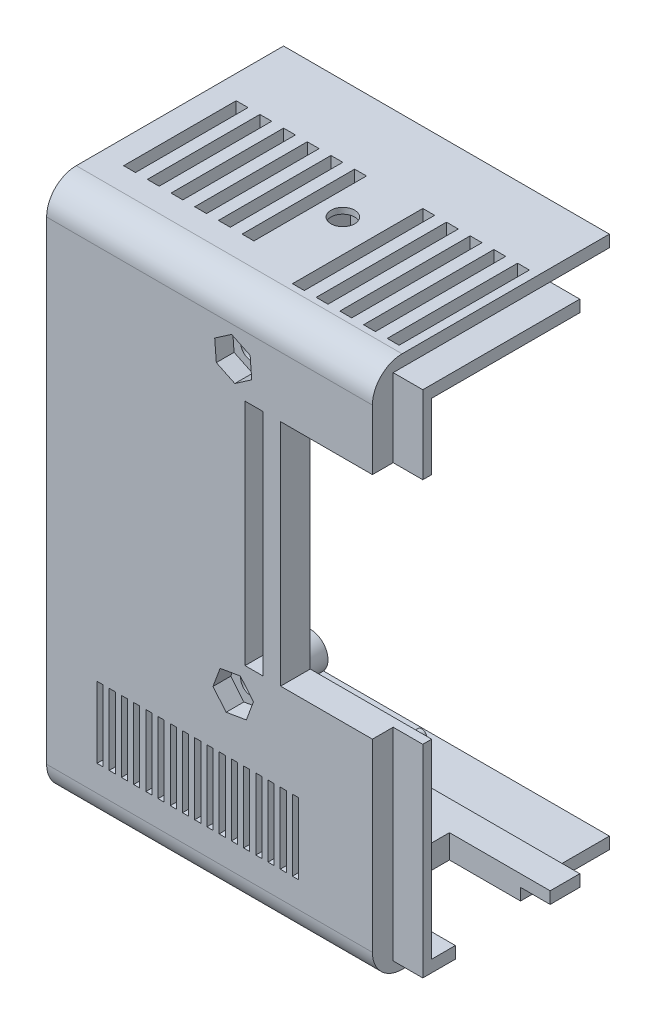
from build123d import *

# Parameters (mm, degrees)
SKETCH1_W                       = 110
SKETCH1_H                       = 90
SKETCH1_R                       = 1.75
BOSS_EXTRUDE1_DEPTH             = 5
SKETCH2_R                       = 3
BOSS_EXTRUDE2_DEPTH             = 8
CUT_EXTRUDE1_REACH              = 78.118
SKETCH3_R                       = 1.5
CUT_EXTRUDE2_DEPTH              = 3
SKETCH5_W                       = 5
SKETCH5_H                       = 90
BOSS_EXTRUDE3_DEPTH             = 35
CUT_EXTRUDE3_REACH              = 121.478
SKETCH6_W                       = 4.5
SKETCH6_H                       = 4
SKETCH6_R                       = 1.75
SKETCH7_R                       = 2.25
BOSS_EXTRUDE4_DEPTH             = 2
CUT_EXTRUDE4_REACH              = 119.724
SKETCH8_R                       = 1.5
SKETCH9_W                       = 105
SKETCH9_H                       = 4
BOSS_EXTRUDE5_DEPTH             = 35
CUT_EXTRUDE7_REACH              = 112.549
SKETCH13_W                      = 50
SKETCH13_H                      = 16
SKETCH15_W                      = 3
SKETCH15_H                      = 19.333856647
CUT_EXTRUDE9_DEPTH              = 10
SKETCH18_R                      = 5
BOSS_EXTRUDE7_DEPTH             = 35
CUT_EXTRUDE10_REACH             = 121.478
SKETCH20_R                      = 3
CUT_EXTRUDE11_REACH             = 87
SKETCH21_R                      = 1.75
CUT_EXTRUDE12_DEPTH             = 30
CUT_EXTRUDE13_REACH             = 112.549
SKETCH23_R                      = 2
CUT_EXTRUDE13_DIRECTION_2_REACH = 112.549
CUT_EXTRUDE14_DEPTH             = 3
CUT_EXTRUDE15_DEPTH             = 3
SKETCH27_R                      = 2.5
BOSS_EXTRUDE9_DEPTH             = 10
SKETCH28_R                      = 0.85
BOSS_EXTRUDE10_DEPTH            = 3
SKETCH29_W                      = 2
SKETCH29_H                      = 82
BOSS_EXTRUDE11_DEPTH            = 10
CUT_EXTRUDE16_DEPTH             = 10
FILLET3_R                       = 5
FILLET4_R                       = 5
SKETCH32_W                      = 9
SKETCH32_H                      = 38.667713294
SKETCH32_W_2                    = 6
CUT_EXTRUDE17_DEPTH             = 35
CHAMFER1_SIZE                   = 3
CHAMFER1_SIZE_2                 = 5.196152423
SKETCH34_W                      = 2
SKETCH34_H                      = 82
BOSS_EXTRUDE12_DEPTH            = 25
SKETCH35_W                      = 1
SKETCH35_H                      = 82
CUT_EXTRUDE18_DEPTH             = 10
CUT_EXTRUDE19_REACH             = 124.123
SKETCH36_W                      = 20
SKETCH36_H                      = 39
CUT_EXTRUDE21_REACH             = 84.765
SKETCH38_W                      = 1
SKETCH38_H                      = 12
SKETCH38_W_2                    = 1.03125
CUT_EXTRUDE22_DEPTH             = 5
SKETCH40_W                      = 2
SKETCH40_H                      = 22
CUT_EXTRUDE26_DEPTH             = 10
CUT_EXTRUDE30_DEPTH             = 5
CUT_EXTRUDE31_DEPTH             = 83.764726786
CUT_EXTRUDE31_DEPTH_BACK        = 83.764726786
SKETCH44_W                      = 55
SKETCH44_H                      = 90
SKETCH45_W                      = 5
SKETCH45_H                      = 2
BOSS_EXTRUDE13_DEPTH            = 5
CUT_EXTRUDE32_REACH             = 84.765
SKETCH46_W                      = 32.5
SKETCH46_H                      = 82
SKETCH48_W                      = 2
SKETCH48_H                      = 3
BOSS_EXTRUDE14_DEPTH            = 22.5
SKETCH49_W                      = 2
SKETCH49_H                      = 76
BOSS_EXTRUDE15_DEPTH            = 4
SKETCH50_W                      = 1
SKETCH50_H                      = 5
SKETCH50_H_2                    = 7
BOSS_EXTRUDE16_DEPTH            = 10
CUT_EXTRUDE33_START             = -4
SKETCH52_W                      = 2
SKETCH52_H                      = 19
CUT_EXTRUDE33_DEPTH             = 4
CUT_EXTRUDE34_REACH             = 110.743
SKETCH53_W                      = 2
SKETCH53_H                      = 19
BOSS_EXTRUDE17_START            = -10
SKETCH54_W                      = 2.68
SKETCH54_H                      = 2.5
BOSS_EXTRUDE17_DEPTH            = 10


with BuildPart() as part:
    # Sketch1 → Boss-Extrude1 (new body)
    with BuildSketch(Plane.XY):
        with Locations((5, 0)):
            Rectangle(SKETCH1_W, SKETCH1_H)
        with Locations((39.5, 35)):
            Circle(SKETCH1_R, mode=Mode.SUBTRACT)
        with Locations((-18.5, 35)):
            Circle(SKETCH1_R, mode=Mode.SUBTRACT)
        with Locations((-18.5, -14)):
            Circle(SKETCH1_R, mode=Mode.SUBTRACT)
        with Locations((39.5, -14)):
            Circle(SKETCH1_R, mode=Mode.SUBTRACT)
    extrude(amount=BOSS_EXTRUDE1_DEPTH)

    # Sketch2 → Boss-Extrude2 (add)
    with BuildSketch(Plane(origin=(0, 0, 0), x_dir=(-1, 0, 0), z_dir=(0, 0, -1))):
        with Locations(Location((-39.5, 35, 0), (0, 0, 180))):
            Circle(SKETCH2_R)
        with Locations(Location((-39.5, -14, 0), (0, 0, 180))):
            Circle(SKETCH2_R)
        with Locations(Location((18.5, -14, 0), (0, 0, 180))):
            Circle(SKETCH2_R)
        with Locations(Location((18.5, 35, 0), (0, 0, 180))):
            Circle(SKETCH2_R)
    extrude(amount=BOSS_EXTRUDE2_DEPTH)

    # Sketch3 → Cut-Extrude1 (cut, up to next)
    with BuildSketch(Plane(origin=(0, 0, -8), x_dir=(-1, 0, 0), z_dir=(0, 0, -1)), mode=Mode.PRIVATE) as cut_extrude1_sk1:
        with Locations((-39.5, 35)):
            Circle(SKETCH3_R)
    cut_extrude1_tool1 = extrude(cut_extrude1_sk1.sketch, amount=-CUT_EXTRUDE1_REACH, mode=Mode.PRIVATE) & part.part
    # Sketch3 → Cut-Extrude1 (cut, up to next)
    with BuildSketch(Plane(origin=(0, 0, -8), x_dir=(-1, 0, 0), z_dir=(0, 0, -1)), mode=Mode.PRIVATE) as cut_extrude1_sk2:
        with Locations((18.5, 35)):
            Circle(SKETCH3_R)
    cut_extrude1_tool2 = extrude(cut_extrude1_sk2.sketch, amount=-CUT_EXTRUDE1_REACH, mode=Mode.PRIVATE) & part.part
    # Sketch3 → Cut-Extrude1 (cut, up to next)
    with BuildSketch(Plane(origin=(0, 0, -8), x_dir=(-1, 0, 0), z_dir=(0, 0, -1)), mode=Mode.PRIVATE) as cut_extrude1_sk3:
        with Locations((18.5, -14)):
            Circle(SKETCH3_R)
    cut_extrude1_tool3 = extrude(cut_extrude1_sk3.sketch, amount=-CUT_EXTRUDE1_REACH, mode=Mode.PRIVATE) & part.part
    # Sketch3 → Cut-Extrude1 (cut, up to next)
    with BuildSketch(Plane(origin=(0, 0, -8), x_dir=(-1, 0, 0), z_dir=(0, 0, -1)), mode=Mode.PRIVATE) as cut_extrude1_sk4:
        with Locations((-39.5, -14)):
            Circle(SKETCH3_R)
    cut_extrude1_tool4 = extrude(cut_extrude1_sk4.sketch, amount=-CUT_EXTRUDE1_REACH, mode=Mode.PRIVATE) & part.part
    add(cut_extrude1_tool1.solids().sort_by_distance((39.5, 35, -8))[0], mode=Mode.SUBTRACT)
    add(cut_extrude1_tool2.solids().sort_by_distance((-18.5, 35, -8))[0], mode=Mode.SUBTRACT)
    add(cut_extrude1_tool3.solids().sort_by_distance((-18.5, -14, -8))[0], mode=Mode.SUBTRACT)
    add(cut_extrude1_tool4.solids().sort_by_distance((39.5, -14, -8))[0], mode=Mode.SUBTRACT)

    # Sketch4 → Cut-Extrude2 (cut)
    with BuildSketch(Plane.XY.offset(5)):
        Polygon((-21.354132917, 33.036858311), (-18.226935885, 31.546677543), (-15.372802968, 33.509819232), (-15.645867083, 36.963141689), (-18.773064115, 38.453322457), (-21.627197032, 36.490180768), align=None)
        Polygon((38.538923104, 31.671887742), (41.901691314, 32.503626864), (42.86276821, 35.831739122), (40.461076896, 38.328112258), (37.098308686, 37.496373136), (36.13723179, 34.168260878), align=None)
        Polygon((38.235847366, -17.225200477), (41.661029228, -16.707388534), (42.925181863, -13.482188057), (40.764152634, -10.774799523), (37.338970772, -11.292611466), (36.074818137, -14.517811943), align=None)
        Polygon((-19.700941245, -17.249267629), (-16.286522312, -16.664679441), (-15.085581067, -13.415411812), (-17.299058755, -10.750732371), (-20.713477688, -11.335320559), (-21.914418933, -14.584588188), align=None)
    extrude(amount=-CUT_EXTRUDE2_DEPTH, mode=Mode.SUBTRACT)

    # Sketch5 → Boss-Extrude3 (add)
    with BuildSketch(Plane(origin=(0, 0, 0), x_dir=(-1, 0, 0), z_dir=(0, 0, -1))):
        with Locations((-57.5, 0)):
            Rectangle(SKETCH5_W, SKETCH5_H)
    extrude(amount=BOSS_EXTRUDE3_DEPTH)

    # Sketch6 → Cut-Extrude3 (cut, up to next)
    with BuildSketch(Plane.ZY.offset(-55), mode=Mode.PRIVATE) as cut_extrude3_sk1:
        with Locations((-17.25, -2)):
            Rectangle(SKETCH6_W, SKETCH6_H)
    cut_extrude3_tool1 = extrude(cut_extrude3_sk1.sketch, amount=-CUT_EXTRUDE3_REACH, mode=Mode.PRIVATE) & part.part
    # Sketch6 → Cut-Extrude3 (cut, up to next)
    with BuildSketch(Plane.ZY.offset(-55), mode=Mode.PRIVATE) as cut_extrude3_sk2:
        with Locations((-17.25, 2)):
            Rectangle(SKETCH6_W, SKETCH6_H)
    cut_extrude3_tool2 = extrude(cut_extrude3_sk2.sketch, amount=-CUT_EXTRUDE3_REACH, mode=Mode.PRIVATE) & part.part
    # Sketch6 → Cut-Extrude3 (cut, up to next)
    with BuildSketch(Plane.ZY.offset(-55), mode=Mode.PRIVATE) as cut_extrude3_sk3:
        with Locations((-21.75, 2)):
            Rectangle(SKETCH6_W, SKETCH6_H)
    cut_extrude3_tool3 = extrude(cut_extrude3_sk3.sketch, amount=-CUT_EXTRUDE3_REACH, mode=Mode.PRIVATE) & part.part
    # Sketch6 → Cut-Extrude3 (cut, up to next)
    with BuildSketch(Plane.ZY.offset(-55), mode=Mode.PRIVATE) as cut_extrude3_sk4:
        with Locations((-21.75, -2)):
            Rectangle(SKETCH6_W, SKETCH6_H)
    cut_extrude3_tool4 = extrude(cut_extrude3_sk4.sketch, amount=-CUT_EXTRUDE3_REACH, mode=Mode.PRIVATE) & part.part
    # Sketch6 → Cut-Extrude3 (cut, up to next)
    with BuildSketch(Plane.ZY.offset(-55), mode=Mode.PRIVATE) as cut_extrude3_sk5:
        with Locations(Location((-32, -10.5, 0), (0, 0, 270))):
            Circle(SKETCH6_R)
    cut_extrude3_tool5 = extrude(cut_extrude3_sk5.sketch, amount=-CUT_EXTRUDE3_REACH, mode=Mode.PRIVATE) & part.part
    # Sketch6 → Cut-Extrude3 (cut, up to next)
    with BuildSketch(Plane.ZY.offset(-55), mode=Mode.PRIVATE) as cut_extrude3_sk6:
        with Locations(Location((-32, 10.5, 0), (0, 0, 270))):
            Circle(SKETCH6_R)
    cut_extrude3_tool6 = extrude(cut_extrude3_sk6.sketch, amount=-CUT_EXTRUDE3_REACH, mode=Mode.PRIVATE) & part.part
    # Sketch6 → Cut-Extrude3 (cut, up to next)
    with BuildSketch(Plane.ZY.offset(-55), mode=Mode.PRIVATE) as cut_extrude3_sk7:
        with Locations(Location((-19.5, 10.5, 0), (0, 0, 270))):
            Circle(SKETCH6_R)
    cut_extrude3_tool7 = extrude(cut_extrude3_sk7.sketch, amount=-CUT_EXTRUDE3_REACH, mode=Mode.PRIVATE) & part.part
    # Sketch6 → Cut-Extrude3 (cut, up to next)
    with BuildSketch(Plane.ZY.offset(-55), mode=Mode.PRIVATE) as cut_extrude3_sk8:
        with Locations(Location((-19.5, -10.5, 0), (0, 0, 270))):
            Circle(SKETCH6_R)
    cut_extrude3_tool8 = extrude(cut_extrude3_sk8.sketch, amount=-CUT_EXTRUDE3_REACH, mode=Mode.PRIVATE) & part.part
    add(cut_extrude3_tool1.solids().sort_by_distance((55, -2, -17.25))[0], mode=Mode.SUBTRACT)
    add(cut_extrude3_tool2.solids().sort_by_distance((55, 2, -17.25))[0], mode=Mode.SUBTRACT)
    add(cut_extrude3_tool3.solids().sort_by_distance((55, 2, -21.75))[0], mode=Mode.SUBTRACT)
    add(cut_extrude3_tool4.solids().sort_by_distance((55, -2, -21.75))[0], mode=Mode.SUBTRACT)
    add(cut_extrude3_tool5.solids().sort_by_distance((55, -10.5, -32))[0], mode=Mode.SUBTRACT)
    add(cut_extrude3_tool6.solids().sort_by_distance((55, 10.5, -32))[0], mode=Mode.SUBTRACT)
    add(cut_extrude3_tool7.solids().sort_by_distance((55, 10.5, -19.5))[0], mode=Mode.SUBTRACT)
    add(cut_extrude3_tool8.solids().sort_by_distance((55, -10.5, -19.5))[0], mode=Mode.SUBTRACT)

    # Sketch7 → Boss-Extrude4 (add)
    with BuildSketch(Plane.ZY.offset(-55)):
        with Locations(Location((-19.5, 10.5, 0), (0, 0, 90))):
            Circle(SKETCH7_R)
        with Locations(Location((-19.5, -10.5, 0), (0, 0, 90))):
            Circle(SKETCH7_R)
        with Locations(Location((-32, -10.5, 0), (0, 0, 90))):
            Circle(SKETCH7_R)
        with Locations(Location((-32, 10.5, 0), (0, 0, 90))):
            Circle(SKETCH7_R)
    extrude(amount=BOSS_EXTRUDE4_DEPTH)

    # Sketch8 → Cut-Extrude4 (cut, up to next)
    with BuildSketch(Plane.ZY.offset(-53), mode=Mode.PRIVATE) as cut_extrude4_sk1:
        with Locations(Location((-32, 10.5, 0), (0, 0, 270))):
            Circle(SKETCH8_R)
    cut_extrude4_tool1 = extrude(cut_extrude4_sk1.sketch, amount=-CUT_EXTRUDE4_REACH, mode=Mode.PRIVATE) & part.part
    # Sketch8 → Cut-Extrude4 (cut, up to next)
    with BuildSketch(Plane.ZY.offset(-53), mode=Mode.PRIVATE) as cut_extrude4_sk2:
        with Locations(Location((-19.5, 10.5, 0), (0, 0, 270))):
            Circle(SKETCH8_R)
    cut_extrude4_tool2 = extrude(cut_extrude4_sk2.sketch, amount=-CUT_EXTRUDE4_REACH, mode=Mode.PRIVATE) & part.part
    # Sketch8 → Cut-Extrude4 (cut, up to next)
    with BuildSketch(Plane.ZY.offset(-53), mode=Mode.PRIVATE) as cut_extrude4_sk3:
        with Locations(Location((-19.5, -10.5, 0), (0, 0, 270))):
            Circle(SKETCH8_R)
    cut_extrude4_tool3 = extrude(cut_extrude4_sk3.sketch, amount=-CUT_EXTRUDE4_REACH, mode=Mode.PRIVATE) & part.part
    # Sketch8 → Cut-Extrude4 (cut, up to next)
    with BuildSketch(Plane.ZY.offset(-53), mode=Mode.PRIVATE) as cut_extrude4_sk4:
        with Locations(Location((-32, -10.5, 0), (0, 0, 270))):
            Circle(SKETCH8_R)
    cut_extrude4_tool4 = extrude(cut_extrude4_sk4.sketch, amount=-CUT_EXTRUDE4_REACH, mode=Mode.PRIVATE) & part.part
    add(cut_extrude4_tool1.solids().sort_by_distance((53, 10.5, -32))[0], mode=Mode.SUBTRACT)
    add(cut_extrude4_tool2.solids().sort_by_distance((53, 10.5, -19.5))[0], mode=Mode.SUBTRACT)
    add(cut_extrude4_tool3.solids().sort_by_distance((53, -10.5, -19.5))[0], mode=Mode.SUBTRACT)
    add(cut_extrude4_tool4.solids().sort_by_distance((53, -10.5, -32))[0], mode=Mode.SUBTRACT)

    # Sketch9 → Boss-Extrude5 (add)
    with BuildSketch(Plane(origin=(0, 0, 0), x_dir=(-1, 0, 0), z_dir=(0, 0, -1))):
        with Locations((-2.5, 43)):
            Rectangle(SKETCH9_W, SKETCH9_H)
        with Locations((-2.5, -43)):
            Rectangle(SKETCH9_W, SKETCH9_H)
    extrude(amount=BOSS_EXTRUDE5_DEPTH)

    # Sketch13 → Cut-Extrude7 (cut, up to next)
    with BuildSketch(Plane(origin=(0, -41, 0), x_dir=(1, 0, 0), z_dir=(0, 1, 0)), mode=Mode.PRIVATE) as cut_extrude7_sk1:
        with Locations((18, 12)):
            Rectangle(SKETCH13_W, SKETCH13_H)
    cut_extrude7_tool1 = extrude(cut_extrude7_sk1.sketch, amount=-CUT_EXTRUDE7_REACH, mode=Mode.PRIVATE) & part.part
    add(cut_extrude7_tool1.solids().sort_by_distance((18, -41, -12))[0], mode=Mode.SUBTRACT)

    # Sketch15 → Cut-Extrude9 (cut)
    with BuildSketch(Plane.XY.offset(5)):
        with Locations((-15, 0.833071676)):
            Rectangle(SKETCH15_W, SKETCH15_H)
        with Locations((-9, 0.833071676)):
            Rectangle(SKETCH15_W, SKETCH15_H)
        with Locations((-3, 0.833071676)):
            Rectangle(SKETCH15_W, SKETCH15_H)
        with Locations((3, 0.833071676)):
            Rectangle(SKETCH15_W, SKETCH15_H)
        with Locations((9, 0.833071676)):
            Rectangle(SKETCH15_W, SKETCH15_H)
        with Locations((15, 0.833071676)):
            Rectangle(SKETCH15_W, SKETCH15_H)
        with Locations((21, 0.833071676)):
            Rectangle(SKETCH15_W, SKETCH15_H)
        with Locations((27, 0.833071676)):
            Rectangle(SKETCH15_W, SKETCH15_H)
        with Locations((33, 0.833071676)):
            Rectangle(SKETCH15_W, SKETCH15_H)
        with Locations((-15, 20.166928324)):
            Rectangle(SKETCH15_W, SKETCH15_H)
        with Locations((-9, 20.166928324)):
            Rectangle(SKETCH15_W, SKETCH15_H)
        with Locations((-3, 20.166928324)):
            Rectangle(SKETCH15_W, SKETCH15_H)
        with Locations((3, 20.166928324)):
            Rectangle(SKETCH15_W, SKETCH15_H)
        with Locations((9, 20.166928324)):
            Rectangle(SKETCH15_W, SKETCH15_H)
        with Locations((15, 20.166928324)):
            Rectangle(SKETCH15_W, SKETCH15_H)
        with Locations((21, 20.166928324)):
            Rectangle(SKETCH15_W, SKETCH15_H)
        with Locations((27, 20.166928324)):
            Rectangle(SKETCH15_W, SKETCH15_H)
        with Locations((33, 20.166928324)):
            Rectangle(SKETCH15_W, SKETCH15_H)
    extrude(amount=-CUT_EXTRUDE9_DEPTH, mode=Mode.SUBTRACT)

    # Sketch18 → Boss-Extrude7 (add)
    with BuildSketch(Plane(origin=(0, 0, 0), x_dir=(-1, 0, 0), z_dir=(0, 0, -1))):
        with Locations(Location((-49, -35, 0), (0, 0, 180))):
            Circle(SKETCH18_R)
        with Locations(Location((-49, 35, 0), (0, 0, 180))):
            Circle(SKETCH18_R)
    extrude(amount=BOSS_EXTRUDE7_DEPTH)

    # Sketch20 → Cut-Extrude10 (cut, up to next)
    with BuildSketch(Plane.ZY.offset(-55), mode=Mode.PRIVATE) as cut_extrude10_sk1:
        with Locations(Location((-19, -22.892244298, 0), (0, 0, 270))):
            Circle(SKETCH20_R)
    cut_extrude10_tool1 = extrude(cut_extrude10_sk1.sketch, amount=-CUT_EXTRUDE10_REACH, mode=Mode.PRIVATE) & part.part
    # Sketch20 → Cut-Extrude10 (cut, up to next)
    with BuildSketch(Plane.ZY.offset(-55), mode=Mode.PRIVATE) as cut_extrude10_sk2:
        with Locations(Location((-9, -22.892244298, 0), (0, 0, 270))):
            Circle(SKETCH20_R)
    cut_extrude10_tool2 = extrude(cut_extrude10_sk2.sketch, amount=-CUT_EXTRUDE10_REACH, mode=Mode.PRIVATE) & part.part
    add(cut_extrude10_tool1.solids().sort_by_distance((55, -22.892244, -19))[0], mode=Mode.SUBTRACT)
    add(cut_extrude10_tool2.solids().sort_by_distance((55, -22.892244, -9))[0], mode=Mode.SUBTRACT)

    # Sketch21 → Cut-Extrude11 (cut, up to next)
    with BuildSketch(Plane(origin=(0, 0, -35), x_dir=(-1, 0, 0), z_dir=(0, 0, -1)), mode=Mode.PRIVATE) as cut_extrude11_sk1:
        with Locations((-49, 35)):
            Circle(SKETCH21_R)
    cut_extrude11_tool1 = extrude(cut_extrude11_sk1.sketch, amount=-CUT_EXTRUDE11_REACH, mode=Mode.PRIVATE) & part.part
    # Sketch21 → Cut-Extrude11 (cut, up to next)
    with BuildSketch(Plane(origin=(0, 0, -35), x_dir=(-1, 0, 0), z_dir=(0, 0, -1)), mode=Mode.PRIVATE) as cut_extrude11_sk2:
        with Locations((-49, -35)):
            Circle(SKETCH21_R)
    cut_extrude11_tool2 = extrude(cut_extrude11_sk2.sketch, amount=-CUT_EXTRUDE11_REACH, mode=Mode.PRIVATE) & part.part
    add(cut_extrude11_tool1.solids().sort_by_distance((49, 35, -35))[0], mode=Mode.SUBTRACT)
    add(cut_extrude11_tool2.solids().sort_by_distance((49, -35, -35))[0], mode=Mode.SUBTRACT)

    # Sketch22 → Cut-Extrude12 (cut)
    with BuildSketch(Plane.XY.offset(5)):
        Polygon((46.919353747, 38.12317859), (45.254924874, 34.759696783), (47.335571127, 31.636518194), (51.080646253, 31.87682141), (52.745075126, 35.240303217), (50.664428873, 38.363481806), align=None)
        Polygon((52.75277675, -35), (50.876388375, -31.75), (47.123611625, -31.75), (45.24722325, -35), (47.123611625, -38.25), (50.876388375, -38.25), align=None)
    extrude(amount=-CUT_EXTRUDE12_DEPTH, mode=Mode.SUBTRACT)

    # Sketch23 → Cut-Extrude13 (cut, up to next)
    with BuildSketch(Plane(origin=(0, -41, 0), x_dir=(1, 0, 0), z_dir=(0, 1, 0)), mode=Mode.PRIVATE) as cut_extrude13_sk1:
        with Locations(Location((-20, 15, 0), (0, 0, 90))):
            Circle(SKETCH23_R)
    cut_extrude13_tool1 = extrude(cut_extrude13_sk1.sketch, amount=-CUT_EXTRUDE13_REACH, mode=Mode.PRIVATE) & part.part
    add(cut_extrude13_tool1.solids().sort_by_distance((-20, -41, -15))[0], mode=Mode.SUBTRACT)

    # Sketch23 → Cut-Extrude13 direction 2 (cut, up to next)
    with BuildSketch(Plane(origin=(0, -41, 0), x_dir=(1, 0, 0), z_dir=(0, 1, 0)), mode=Mode.PRIVATE) as cut_extrude13_direction_2_sk1:
        with Locations(Location((-20, 15, 0), (0, 0, 90))):
            Circle(SKETCH23_R)
    cut_extrude13_direction_2_tool1 = extrude(cut_extrude13_direction_2_sk1.sketch, amount=CUT_EXTRUDE13_DIRECTION_2_REACH, mode=Mode.PRIVATE) & part.part
    add(cut_extrude13_direction_2_tool1.solids().sort_by_distance((-20, -41, -15))[0], mode=Mode.SUBTRACT)

    # Sketch24 → Cut-Extrude14 (cut)
    with BuildSketch(Plane(origin=(0, 41, 0), x_dir=(-1, 0, 0), z_dir=(0, -1, 0))):
        Polygon((16.535898385, 15), (18.267949192, 12), (21.732050808, 12), (23.464101615, 15), (21.732050808, 18), (18.267949192, 18), align=None)
    extrude(amount=-CUT_EXTRUDE14_DEPTH, mode=Mode.SUBTRACT)

    # Sketch25 → Cut-Extrude15 (cut)
    with BuildSketch(Plane(origin=(0, -41, 0), x_dir=(1, 0, 0), z_dir=(0, 1, 0))):
        Polygon((-23.452057687, 14.711386547), (-21.476082261, 11.866123621), (-18.024024574, 12.154737074), (-16.547942313, 15.288613453), (-18.523917739, 18.133876379), (-21.975975426, 17.845262926), align=None)
    extrude(amount=-CUT_EXTRUDE15_DEPTH, mode=Mode.SUBTRACT)

    # Sketch27 → Boss-Extrude9 (add)
    with BuildSketch(Plane(origin=(0, 0, 0), x_dir=(-1, 0, 0), z_dir=(0, 0, -1))):
        with Locations(Location((4.68, -22, 0), (0, 0, 180))):
            Circle(SKETCH27_R)
        with Locations(Location((4.68, -37.24, 0), (0, 0, 180))):
            Circle(SKETCH27_R)
        with Locations(Location((45.32, -37.24, 0), (0, 0, 180))):
            Circle(SKETCH27_R)
        with Locations(Location((45.32, -22, 0), (0, 0, 180))):
            Circle(SKETCH27_R)
    extrude(amount=BOSS_EXTRUDE9_DEPTH)

    # Sketch28 → Boss-Extrude10 (add)
    with BuildSketch(Plane(origin=(0, 0, -10), x_dir=(-1, 0, 0), z_dir=(0, 0, -1))):
        with Locations((4.68, -22)):
            Circle(SKETCH28_R)
        with Locations((4.68, -37.24)):
            Circle(SKETCH28_R)
        with Locations((45.32, -37.24)):
            Circle(SKETCH28_R)
        with Locations((45.32, -22)):
            Circle(SKETCH28_R)
    extrude(amount=BOSS_EXTRUDE10_DEPTH)

    # Sketch29 → Boss-Extrude11 (add)
    with BuildSketch(Plane(origin=(0, 0, 0), x_dir=(-1, 0, 0), z_dir=(0, 0, -1))):
        with Locations((49, 0)):
            Rectangle(SKETCH29_W, SKETCH29_H)
    extrude(amount=BOSS_EXTRUDE11_DEPTH)

    # Sketch30 → Cut-Extrude16 (cut)
    with BuildSketch(Plane(origin=(0, 0, -35), x_dir=(-1, 0, 0), z_dir=(0, 0, -1))):
        Polygon((-55, 41), (50, 41), (50, 43), (-57, 43), (-57, 15), (-55, 15), align=None)
        Polygon((50, -43), (50, -41), (-55, -41), (-55, -15), (-57, -15), (-57, -43), align=None)
    extrude(amount=-CUT_EXTRUDE16_DEPTH, mode=Mode.SUBTRACT)

    # Fillet3
    fillet3_edges = [part.edges().sort_by_distance(p)[0] for p in [
        (60, 45, -15),
        (60, -45, -15),
    ]]
    fillet(fillet3_edges, radius=FILLET3_R)

    # Fillet4
    fillet4_edges = [part.edges().sort_by_distance(p)[0] for p in [
        (60, 0, 5),
        (2.5, -45, 5),
        (2.5, 45, 5),
        (58.535533906, 43.535533906, 5),
        (58.535533906, -43.535533906, 5),
    ]]
    fillet(fillet4_edges, radius=FILLET4_R)

    # Sketch32 → Cut-Extrude17 (cut)
    with BuildSketch(Plane.XY.offset(5)):
        with Locations((-3, 10.5)):
            Rectangle(SKETCH32_W, SKETCH32_H)
        with Locations((4.5, 10.5)):
            Rectangle(SKETCH32_W_2, SKETCH32_H)
    extrude(amount=-CUT_EXTRUDE17_DEPTH, mode=Mode.SUBTRACT)

    # Chamfer1
    # the kernel refuses this chamfer: 5.196152423, 3 mm, written as the material it takes off along each edge
    with BuildSketch(Plane(origin=(60, -4, -15), x_dir=(0.0578938624026709, 0, 0.9983227437537926), z_dir=(0, 1, 0)), Plane(origin=(60, 4, -24), x_dir=(0.057893862402670936, 0, -0.9983227437537926), z_dir=(0, -1, 0))) as chamfer1_piece_1:
        Polygon((CHAMFER1_SIZE * 0.998322743754, -CHAMFER1_SIZE * 0.0578938624027), (-CHAMFER1_SIZE_2 * 0.0578938623994, -CHAMFER1_SIZE_2 * 0.998322743697), (0, 0), align=None)
    extrude(amount=8, mode=Mode.SUBTRACT)
    with BuildSketch(Plane(origin=(60, 4, -15), x_dir=(0.05789386240267102, 0.9983227437537926, 0), z_dir=(0, 0, -1)), Plane(origin=(60, -4, -24), x_dir=(0.05789386240267082, -0.9983227437537926, 0), z_dir=(0, 0, 1))) as chamfer1_piece_2:
        Polygon((CHAMFER1_SIZE * 0.998322743754, -CHAMFER1_SIZE * 0.0578938624027), (-CHAMFER1_SIZE_2 * 0.0578938623994, -CHAMFER1_SIZE_2 * 0.998322743697), (0, 0), align=None)
    extrude(amount=9, mode=Mode.SUBTRACT)
    with BuildSketch(Plane(origin=(60, -4, -24), x_dir=(0.05789386240267082, -0.9983227437537926, 0), z_dir=(0, 0, 1))) as chamfer1_piece_3a_section:
        Polygon((CHAMFER1_SIZE * 0.998322743754, -CHAMFER1_SIZE * 0.0578938624027), (-CHAMFER1_SIZE_2 * 0.0578938623994, -CHAMFER1_SIZE_2 * 0.998322743697), (0, 0), align=None)
    chamfer1_piece_3a = extrude(amount=22.442891912, mode=Mode.PRIVATE)
    chamfer1_piece_3a = split(chamfer1_piece_3a, bisect_by=Plane(origin=(58.257302597, -4.962009686, -15), z_dir=(0, 0, 1)), keep=Keep.TOP, mode=Mode.PRIVATE)
    with BuildSketch(Plane(origin=(60, -17.442891912, -15), x_dir=(0.0578938624026709, 0, 0.9983227437537926), z_dir=(0, 1, 0))) as chamfer1_piece_3b_section:
        Polygon((CHAMFER1_SIZE * 0.998322743754, -CHAMFER1_SIZE * 0.0578938624027), (-CHAMFER1_SIZE_2 * 0.0578938623994, -CHAMFER1_SIZE_2 * 0.998322743697), (0, 0), align=None)
    chamfer1_piece_3b = extrude(amount=21.442891912, mode=Mode.PRIVATE)
    chamfer1_piece_3b = split(chamfer1_piece_3b, bisect_by=Plane(origin=(58.257302597, -4, -14.037990314), z_dir=(0, -1, 0)), keep=Keep.TOP, mode=Mode.PRIVATE)
    chamfer1_piece_3 = chamfer1_piece_3a & chamfer1_piece_3b
    add(chamfer1_piece_3, mode=Mode.SUBTRACT)
    with BuildSketch(Plane(origin=(60, -4, -15), x_dir=(0.0578938624026709, 0, 0.9983227437537926), z_dir=(0, 1, 0))) as chamfer1_piece_4a_section:
        Polygon((CHAMFER1_SIZE * 0.998322743754, -CHAMFER1_SIZE * 0.0578938624027), (-CHAMFER1_SIZE_2 * 0.0578938623994, -CHAMFER1_SIZE_2 * 0.998322743697), (0, 0), align=None)
    chamfer1_piece_4a = extrude(amount=21.442891912, mode=Mode.PRIVATE)
    chamfer1_piece_4a = split(chamfer1_piece_4a, bisect_by=Plane(origin=(58.257302597, 4, -14.037990314), z_dir=(0, 1, 0)), keep=Keep.TOP, mode=Mode.PRIVATE)
    with BuildSketch(Plane(origin=(60, 4, -1.557108088), x_dir=(0.0578938624026709, 0.9983227437537926, 0), z_dir=(0, 0, -1))) as chamfer1_piece_4b_section:
        Polygon((CHAMFER1_SIZE * 0.998322743754, -CHAMFER1_SIZE * 0.0578938624027), (-CHAMFER1_SIZE_2 * 0.0578938623994, -CHAMFER1_SIZE_2 * 0.998322743697), (0, 0), align=None)
    chamfer1_piece_4b = extrude(amount=22.442891912, mode=Mode.PRIVATE)
    chamfer1_piece_4b = split(chamfer1_piece_4b, bisect_by=Plane(origin=(58.257302597, 4.962009686, -15), z_dir=(0, 0, 1)), keep=Keep.TOP, mode=Mode.PRIVATE)
    chamfer1_piece_4 = chamfer1_piece_4a & chamfer1_piece_4b
    add(chamfer1_piece_4, mode=Mode.SUBTRACT)
    with BuildSketch(Plane(origin=(60, 17.442891912, -24), x_dir=(0.057893862402670936, 0, -0.9983227437537926), z_dir=(0, -1, 0))) as chamfer1_piece_5a_section:
        Polygon((CHAMFER1_SIZE * 0.998322743754, -CHAMFER1_SIZE * 0.0578938624027), (-CHAMFER1_SIZE_2 * 0.0578938623994, -CHAMFER1_SIZE_2 * 0.998322743697), (0, 0), align=None)
    chamfer1_piece_5a = extrude(amount=21.442891912, mode=Mode.PRIVATE)
    chamfer1_piece_5a = split(chamfer1_piece_5a, bisect_by=Plane(origin=(58.257302597, 4, -24.962009686), z_dir=(0, 1, 0)), keep=Keep.TOP, mode=Mode.PRIVATE)
    with BuildSketch(Plane(origin=(60, 4, -15), x_dir=(0.05789386240267102, 0.9983227437537926, 0), z_dir=(0, 0, -1))) as chamfer1_piece_5b_section:
        Polygon((CHAMFER1_SIZE * 0.998322743754, -CHAMFER1_SIZE * 0.0578938624027), (-CHAMFER1_SIZE_2 * 0.0578938623994, -CHAMFER1_SIZE_2 * 0.998322743697), (0, 0), align=None)
    chamfer1_piece_5b = extrude(amount=22.442891912, mode=Mode.PRIVATE)
    chamfer1_piece_5b = split(chamfer1_piece_5b, bisect_by=Plane(origin=(58.257302597, 4.962009686, -24), z_dir=(0, 0, -1)), keep=Keep.TOP, mode=Mode.PRIVATE)
    chamfer1_piece_5 = chamfer1_piece_5a & chamfer1_piece_5b
    add(chamfer1_piece_5, mode=Mode.SUBTRACT)
    with BuildSketch(Plane(origin=(60, -4, -37.442891912), x_dir=(0.0578938624026709, -0.9983227437537926, 0), z_dir=(0, 0, 1))) as chamfer1_piece_6a_section:
        Polygon((CHAMFER1_SIZE * 0.998322743754, -CHAMFER1_SIZE * 0.0578938624027), (-CHAMFER1_SIZE_2 * 0.0578938623994, -CHAMFER1_SIZE_2 * 0.998322743697), (0, 0), align=None)
    chamfer1_piece_6a = extrude(amount=22.442891912, mode=Mode.PRIVATE)
    chamfer1_piece_6a = split(chamfer1_piece_6a, bisect_by=Plane(origin=(58.257302597, -4.962009686, -24), z_dir=(0, 0, -1)), keep=Keep.TOP, mode=Mode.PRIVATE)
    with BuildSketch(Plane(origin=(60, 4, -24), x_dir=(0.057893862402670936, 0, -0.9983227437537926), z_dir=(0, -1, 0))) as chamfer1_piece_6b_section:
        Polygon((CHAMFER1_SIZE * 0.998322743754, -CHAMFER1_SIZE * 0.0578938624027), (-CHAMFER1_SIZE_2 * 0.0578938623994, -CHAMFER1_SIZE_2 * 0.998322743697), (0, 0), align=None)
    chamfer1_piece_6b = extrude(amount=21.442891912, mode=Mode.PRIVATE)
    chamfer1_piece_6b = split(chamfer1_piece_6b, bisect_by=Plane(origin=(58.257302597, -4, -24.962009686), z_dir=(0, -1, 0)), keep=Keep.TOP, mode=Mode.PRIVATE)
    chamfer1_piece_6 = chamfer1_piece_6a & chamfer1_piece_6b
    add(chamfer1_piece_6, mode=Mode.SUBTRACT)

    # Sketch34 → Boss-Extrude12 (add)
    with BuildSketch(Plane(origin=(0, 0, -10), x_dir=(-1, 0, 0), z_dir=(0, 0, -1))):
        with Locations((49, 0)):
            Rectangle(SKETCH34_W, SKETCH34_H)
    extrude(amount=BOSS_EXTRUDE12_DEPTH)

    # Sketch35 → Cut-Extrude18 (cut)
    with BuildSketch(Plane(origin=(0, 0, -35), x_dir=(-1, 0, 0), z_dir=(0, 0, -1))):
        with Locations((48.5, 0)):
            Rectangle(SKETCH35_W, SKETCH35_H)
    extrude(amount=-CUT_EXTRUDE18_DEPTH, mode=Mode.SUBTRACT)

    # Sketch36 → Cut-Extrude19 (cut, up to next)
    with BuildSketch(Plane(origin=(-48, 0, 0), x_dir=(0, 0, -1), z_dir=(1, 0, 0)), mode=Mode.PRIVATE) as cut_extrude19_sk1:
        with Locations((12.5, -19.5)):
            Rectangle(SKETCH36_W, SKETCH36_H)
    cut_extrude19_tool1 = extrude(cut_extrude19_sk1.sketch, amount=-CUT_EXTRUDE19_REACH, mode=Mode.PRIVATE) & part.part
    # Sketch36 → Cut-Extrude19 (cut, up to next)
    with BuildSketch(Plane(origin=(-48, 0, 0), x_dir=(0, 0, -1), z_dir=(1, 0, 0)), mode=Mode.PRIVATE) as cut_extrude19_sk2:
        with Locations((12.5, 19.5)):
            Rectangle(SKETCH36_W, SKETCH36_H)
    cut_extrude19_tool2 = extrude(cut_extrude19_sk2.sketch, amount=-CUT_EXTRUDE19_REACH, mode=Mode.PRIVATE) & part.part
    add(cut_extrude19_tool1.solids().sort_by_distance((-48, -19.5, -12.5))[0], mode=Mode.SUBTRACT)
    add(cut_extrude19_tool2.solids().sort_by_distance((-48, 19.5, -12.5))[0], mode=Mode.SUBTRACT)

    # Sketch37 → Cut-Extrude21 (cut, up to next)
    with BuildSketch(Plane(origin=(0, 0, 0), x_dir=(-1, 0, 0), z_dir=(0, 0, -1)), mode=Mode.PRIVATE) as cut_extrude21_sk1:
        with BuildLine():
            Line((-12.82888518, -22.565233381), (-12.82888518, -27.784399533))
            add(Edge.make_bspline(
                [(-12.82888518, -27.784399533), (-12.828959116, -27.877701107), (-12.829100163, -28.055693154), (-12.82815101, -28.309294914), (-12.823911159, -28.536542877), (-12.824316853, -28.738027276), (-12.818810002, -28.913590682), (-12.815588902, -29.062932485), (-12.809058398, -29.185859613), (-12.803163037, -29.314173009), (-12.783183356, -29.45512209), (-12.734415145, -29.611796798), (-12.665676921, -29.761678886), (-12.571828056, -29.899524707), (-12.461201812, -30.024803087), (-12.331011538, -30.129672628), (-12.184833725, -30.213766442), (-12.049559659, -30.264273473), (-11.931636586, -30.2971016), (-11.830543211, -30.315858353), (-11.719284725, -30.335416652), (-11.59697933, -30.348711943), (-11.464480638, -30.360983076), (-11.321239652, -30.366717433), (-11.16721787, -30.373720278), (-11.060943578, -30.373829993), (-11.005909104, -30.37388681)],
                knots=[0, 0, 0, 0, 1.738774286, 3.317071518, 4.726037395, 5.97442001, 7.071511504, 7.999243532, 8.758009548, 9.365399479, 10.393153955, 11.400119887, 12.41338286, 13.454549495, 14.496441349, 15.517209498, 16.555738183, 17.625493024, 18.198739376, 18.835275869, 19.540379274, 20.303533674, 21.126974116, 22.01976714, 22.974530243, 24, 24, 24, 24], degree=3))
            Line((-11.005909104, -30.37388681), (-9.981023341, -30.37388681))
            Line((-9.981023341, -30.37388681), (-9.981023341, -29.073401514))
            add(Edge.make_bspline(
                [(-9.981023341, -29.073401514), (-10.011642891, -29.075359814), (-10.068087135, -29.078969754), (-10.146076929, -29.08332999), (-10.210192653, -29.08635815), (-10.248487025, -29.087330425), (-10.26523536, -29.087755657)],
                knots=[0, 0, 0, 0, 1.293708501, 2.384829249, 3.293592805, 4, 4, 4, 4], degree=3))
            add(Edge.make_bspline(
                [(-10.26523536, -29.087755657), (-10.30217747, -29.086422864), (-10.372358034, -29.083890899), (-10.471308315, -29.063837383), (-10.557939959, -29.030673667), (-10.632287202, -28.984543627), (-10.692143577, -28.926903252), (-10.73929361, -28.862988373), (-10.771949396, -28.792680464), (-10.78894442, -28.710965303), (-10.798257431, -28.609029054), (-10.802524887, -28.475812863), (-10.807414316, -28.306446369), (-10.80767767, -28.181537056), (-10.80782194, -28.113109392)],
                knots=[0, 0, 0, 0, 1.017313736, 1.932635971, 2.767513323, 3.561301267, 4.325979076, 5.043271674, 5.739412137, 6.443003478, 7.331146155, 8.558401061, 10.114627581, 12, 12, 12, 12], degree=3))
            Line((-10.80782194, -28.113109392), (-10.80782194, -22.565233381))
            Line((-10.80782194, -22.565233381), (-12.82888518, -22.565233381))
        make_face()
    cut_extrude21_tool1 = extrude(cut_extrude21_sk1.sketch, amount=-CUT_EXTRUDE21_REACH, mode=Mode.PRIVATE) & part.part
    # Sketch37 → Cut-Extrude21 (cut, up to next)
    with BuildSketch(Plane(origin=(0, 0, 0), x_dir=(-1, 0, 0), z_dir=(0, 0, -1)), mode=Mode.PRIVATE) as cut_extrude21_sk2:
        Polygon((-19.443273967, -22.565233381), (-19.443273967, -24.126964067), (-18.249009325, -24.126964067), (-18.249009325, -30.37388681), (-16.227946085, -30.37388681), (-16.227946085, -24.126964067), (-15.033681442, -24.126964067), (-15.033681442, -22.565233381), align=None)
    cut_extrude21_tool2 = extrude(cut_extrude21_sk2.sketch, amount=-CUT_EXTRUDE21_REACH, mode=Mode.PRIVATE) & part.part
    # Sketch37 → Cut-Extrude21 (cut, up to next)
    with BuildSketch(Plane(origin=(0, 0, 0), x_dir=(-1, 0, 0), z_dir=(0, 0, -1)), mode=Mode.PRIVATE) as cut_extrude21_sk3:
        with BuildLine():
            Line((-27.986859483, -22.565233381), (-27.986859483, -30.37388681))
            Line((-27.986859483, -30.37388681), (-26.241395776, -30.37388681))
            Line((-26.241395776, -30.37388681), (-26.19546252, -25.101610331))
            Line((-26.19546252, -25.101610331), (-25.506463688, -30.37388681))
            Line((-25.506463688, -30.37388681), (-24.128466024, -30.37388681))
            Line((-24.128466024, -30.37388681), (-23.439467192, -25.193476842))
            Line((-23.439467192, -25.193476842), (-23.393533937, -30.37388681))
            Line((-23.393533937, -30.37388681), (-21.648070229, -30.37388681))
            Line((-21.648070229, -30.37388681), (-21.648070229, -22.565233381))
            Line((-21.648070229, -22.565233381), (-24.197365907, -22.565233381))
            add(Edge.make_bspline(
                [(-24.197365907, -22.565233381), (-24.218396853, -22.686290408), (-24.26237065, -22.939409646), (-24.331551407, -23.334974504), (-24.404399288, -23.763350699), (-24.455221966, -24.059506494), (-24.481577926, -24.213088921)],
                knots=[0, 0, 0, 0, 0.881745717, 1.843650135, 2.881745852, 4, 4, 4, 4], degree=3))
            Line((-24.481577926, -24.213088921), (-24.817464856, -26.211185533))
            Line((-24.817464856, -26.211185533), (-25.345697294, -22.565233381))
            Line((-25.345697294, -22.565233381), (-27.986859483, -22.565233381))
        make_face()
    cut_extrude21_tool3 = extrude(cut_extrude21_sk3.sketch, amount=-CUT_EXTRUDE21_REACH, mode=Mode.PRIVATE) & part.part
    # Sketch37 → Cut-Extrude21 (cut, up to next)
    with BuildSketch(Plane(origin=(0, 0, 0), x_dir=(-1, 0, 0), z_dir=(0, 0, -1)), mode=Mode.PRIVATE) as cut_extrude21_sk4:
        Polygon((-34.60124827, -22.565233381), (-34.60124827, -24.126964067), (-33.406983628, -24.126964067), (-33.406983628, -30.37388681), (-31.385920388, -30.37388681), (-31.385920388, -24.126964067), (-30.191655745, -24.126964067), (-30.191655745, -22.565233381), align=None)
    cut_extrude21_tool4 = extrude(cut_extrude21_sk4.sketch, amount=-CUT_EXTRUDE21_REACH, mode=Mode.PRIVATE) & part.part
    # Sketch37 → Cut-Extrude21 (cut, up to next)
    with BuildSketch(Plane(origin=(0, 0, 0), x_dir=(-1, 0, 0), z_dir=(0, 0, -1)), mode=Mode.PRIVATE) as cut_extrude21_sk5:
        with BuildLine():
            Line((-36.806044532, -22.565233381), (-38.261554565, -22.565233381))
            add(Edge.make_bspline(
                [(-38.261554565, -22.565233381), (-38.378304658, -22.565344468), (-38.601772948, -22.565557098), (-38.921888496, -22.571646891), (-39.212339768, -22.580147487), (-39.473690838, -22.590868077), (-39.705784786, -22.606710151), (-39.90827885, -22.625007953), (-40.08131805, -22.645735283), (-40.229195634, -22.671460633), (-40.359531813, -22.704928775), (-40.479824287, -22.748888986), (-40.594925951, -22.80120382), (-40.70349625, -22.866569923), (-40.804772258, -22.943311722), (-40.902373849, -23.027660951), (-40.991202702, -23.125661334), (-41.07667361, -23.232701017), (-41.153934967, -23.354811255), (-41.219273799, -23.493439128), (-41.275355261, -23.648181291), (-41.320846626, -23.819725072), (-41.356079899, -24.007837172), (-41.382120868, -24.212459088), (-41.395531968, -24.433963626), (-41.398059873, -24.58723809), (-41.399370079, -24.666679818)],
                knots=[0, 0, 0, 0, 1.866779899, 3.573154429, 5.119271976, 6.513038993, 7.755301935, 8.838622109, 9.763847579, 10.541210176, 11.237085048, 11.91229758, 12.586642675, 13.255803272, 13.93365463, 14.616667368, 15.3150611, 16.045129356, 16.805014908, 17.619443337, 18.490747182, 19.433519973, 20.453845581, 21.548934602, 22.729619622, 24, 24, 24, 24], degree=3))
            add(Edge.make_bspline(
                [(-41.399370079, -24.666679818), (-41.399191274, -24.738476838), (-41.398848899, -24.875954335), (-41.386055979, -25.073116536), (-41.370872761, -25.25212395), (-41.344069546, -25.412434885), (-41.313664798, -25.554750189), (-41.275424154, -25.67970656), (-41.228655977, -25.785744258), (-41.174335753, -25.875761011), (-41.108509597, -25.951485242), (-41.03031562, -26.018054128), (-40.937184628, -26.074912878), (-40.831387732, -26.12541241), (-40.712155039, -26.168247826), (-40.578880493, -26.202009482), (-40.432256296, -26.229831705), (-40.329140986, -26.240223599), (-40.275440734, -26.245635475)],
                knots=[0, 0, 0, 0, 1.535739318, 2.940645737, 4.22619795, 5.377388088, 6.415609046, 7.338391501, 8.167869762, 8.889512328, 9.579072284, 10.305275152, 11.07790705, 11.906690103, 12.810190808, 13.783547141, 14.845718681, 16, 16, 16, 16], degree=3))
            add(Edge.make_bspline(
                [(-40.275440734, -26.245635475), (-40.323838336, -26.258773), (-40.417219818, -26.284121395), (-40.550947686, -26.324926371), (-40.672010368, -26.370520565), (-40.779303022, -26.42117304), (-40.875602461, -26.472485549), (-40.958787118, -26.528265678), (-41.030176105, -26.587324063), (-41.106265629, -26.668251036), (-41.182713453, -26.770140903), (-41.258924287, -26.889168528), (-41.314010963, -27.004318984), (-41.346351347, -27.102020842), (-41.360602219, -27.190416813), (-41.372666718, -27.278344111), (-41.379953728, -27.390082311), (-41.387289858, -27.525004074), (-41.392637185, -27.682937659), (-41.397391318, -27.86379784), (-41.397779309, -28.068136139), (-41.398820227, -28.21215415), (-41.399370079, -28.288229929)],
                knots=[0, 0, 0, 0, 1.142598363, 2.204603636, 3.184543099, 4.08681795, 4.906404162, 5.66835307, 6.364867417, 7.012577891, 8.194392783, 9.262145755, 10.227668168, 11.096526183, 11.594793942, 12.265491166, 13.118334537, 14.144541448, 15.344519214, 16.718520618, 18.266598052, 20, 20, 20, 20], degree=3))
            Line((-41.399370079, -28.288229929), (-41.399370079, -30.37388681))
            Line((-41.399370079, -30.37388681), (-39.470173349, -30.37388681))
            Line((-39.470173349, -30.37388681), (-39.470173349, -27.73272462))
            add(Edge.make_bspline(
                [(-39.470173349, -27.73272462), (-39.469877417, -27.682006593), (-39.469316142, -27.585813095), (-39.465724741, -27.449328231), (-39.456672855, -27.327783812), (-39.446009608, -27.221367818), (-39.431475057, -27.129890715), (-39.415552052, -27.053543127), (-39.39398321, -26.992367396), (-39.369311573, -26.943763906), (-39.337167728, -26.904520987), (-39.293439627, -26.875222234), (-39.241996662, -26.847416777), (-39.178924306, -26.826161025), (-39.105579593, -26.811252304), (-39.022127928, -26.799931613), (-38.928184226, -26.792820935), (-38.862049601, -26.791690266), (-38.827107773, -26.791092883)],
                knots=[0, 0, 0, 0, 1.760695112, 3.339392938, 4.738153348, 5.990939473, 7.050443991, 7.953034352, 8.693792368, 9.295646617, 9.837944077, 10.432650982, 11.108765438, 11.865186032, 12.731754792, 13.704231872, 14.787044802, 16, 16, 16, 16], degree=3))
            Line((-38.827107773, -26.791092883), (-38.827107773, -30.37388681))
            Line((-38.827107773, -30.37388681), (-36.806044532, -30.37388681))
            Line((-36.806044532, -30.37388681), (-36.806044532, -22.565233381))
        make_face()
        with BuildLine():
            Line((-38.827107773, -23.851364534), (-38.827107773, -25.596828241))
            add(Edge.make_bspline(
                [(-38.827107773, -25.596828241), (-38.882189537, -25.596085982), (-38.984118633, -25.594712427), (-39.123317187, -25.576292612), (-39.2362635, -25.548758049), (-39.315232877, -25.514698704), (-39.36275881, -25.471181783), (-39.393313603, -25.427007907), (-39.416449322, -25.368384183), (-39.436383006, -25.297659316), (-39.451570977, -25.214009775), (-39.463240294, -25.11769962), (-39.467902343, -25.007870492), (-39.469386091, -24.93031759), (-39.470173349, -24.889169024)],
                knots=[0, 0, 0, 0, 1.706714887, 3.158284942, 4.338247242, 5.313333341, 5.775274278, 6.318418262, 6.963057242, 7.71890888, 8.594501264, 9.595306132, 10.724100569, 12, 12, 12, 12], degree=3))
            Line((-39.470173349, -24.889169024), (-39.470173349, -24.45710934))
            add(Edge.make_bspline(
                [(-39.470173349, -24.45710934), (-39.468887138, -24.400053098), (-39.46654657, -24.296225597), (-39.441804514, -24.155767437), (-39.400531743, -24.045376427), (-39.336321635, -23.962191748), (-39.243860812, -23.911345447), (-39.130174921, -23.874519693), (-38.987553748, -23.854764707), (-38.883614228, -23.852562019), (-38.827107773, -23.851364534)],
                knots=[0, 0, 0, 0, 1.304469539, 2.37379483, 3.247992823, 3.979792534, 4.721435155, 5.621572954, 6.706974207, 8, 8, 8, 8], degree=3))
        make_face(mode=Mode.SUBTRACT)
    cut_extrude21_tool5 = extrude(cut_extrude21_sk5.sketch, amount=-CUT_EXTRUDE21_REACH, mode=Mode.PRIVATE) & part.part
    add(cut_extrude21_tool1.solids().sort_by_distance((11.707748, -26.60842, 0))[0], mode=Mode.SUBTRACT)
    add(cut_extrude21_tool2.solids().sort_by_distance((17.238478, -25.872428, 0))[0], mode=Mode.SUBTRACT)
    add(cut_extrude21_tool3.solids().sort_by_distance((24.817972, -26.407738, 0))[0], mode=Mode.SUBTRACT)
    add(cut_extrude21_tool4.solids().sort_by_distance((32.396452, -25.872428, 0))[0], mode=Mode.SUBTRACT)
    add(cut_extrude21_tool5.solids().sort_by_distance((39.02151, -26.449814, 0))[0], mode=Mode.SUBTRACT)


with BuildPart() as cut_extrude21_piece_1:
    # of the separate pieces the step leaves, piece 1, a body of its own (cut_extrude21_pieces)
    add(part.part.solids().sort_by_distance((60, -40, 0))[0])

    # Sketch38 → Cut-Extrude22 (cut)
    with BuildSketch(Plane(origin=(0, 0, 0), x_dir=(-1, 0, 0), z_dir=(0, 0, -1))):
        with Locations((8, -29.62)):
            Rectangle(SKETCH38_W, SKETCH38_H)
        with Locations((10.046875, -29.62)):
            Rectangle(SKETCH38_W_2, SKETCH38_H)
        with Locations((12.109375, -29.62)):
            Rectangle(SKETCH38_W_2, SKETCH38_H)
        with Locations((14.171875, -29.62)):
            Rectangle(SKETCH38_W_2, SKETCH38_H)
        with Locations((16.234375, -29.62)):
            Rectangle(SKETCH38_W_2, SKETCH38_H)
        with Locations((18.296875, -29.62)):
            Rectangle(SKETCH38_W_2, SKETCH38_H)
        with Locations((20.359375, -29.62)):
            Rectangle(SKETCH38_W_2, SKETCH38_H)
        with Locations((22.421875, -29.62)):
            Rectangle(SKETCH38_W_2, SKETCH38_H)
        with Locations((24.484375, -29.62)):
            Rectangle(SKETCH38_W_2, SKETCH38_H)
        with Locations((26.546875, -29.62)):
            Rectangle(SKETCH38_W_2, SKETCH38_H)
        with Locations((28.609375, -29.62)):
            Rectangle(SKETCH38_W_2, SKETCH38_H)
        with Locations((30.671875, -29.62)):
            Rectangle(SKETCH38_W_2, SKETCH38_H)
        with Locations((32.734375, -29.62)):
            Rectangle(SKETCH38_W_2, SKETCH38_H)
        with Locations((34.796875, -29.62)):
            Rectangle(SKETCH38_W_2, SKETCH38_H)
        with Locations((36.859375, -29.62)):
            Rectangle(SKETCH38_W_2, SKETCH38_H)
        with Locations((38.921875, -29.62)):
            Rectangle(SKETCH38_W_2, SKETCH38_H)
        with Locations((40.984375, -29.62)):
            Rectangle(SKETCH38_W_2, SKETCH38_H)
    extrude(amount=-CUT_EXTRUDE22_DEPTH, mode=Mode.SUBTRACT)

    # Sketch40 → Cut-Extrude26 (cut)
    with BuildSketch(Plane.XZ.offset(-41)):
        with Locations((-13.5, -12)):
            Rectangle(SKETCH40_W, SKETCH40_H)
        with Locations((-9.5, -12)):
            Rectangle(SKETCH40_W, SKETCH40_H)
        with Locations((-5.5, -12)):
            Rectangle(SKETCH40_W, SKETCH40_H)
        with Locations((-1.5, -12)):
            Rectangle(SKETCH40_W, SKETCH40_H)
        with Locations((2.5, -12)):
            Rectangle(SKETCH40_W, SKETCH40_H)
        with Locations((6.5, -12)):
            Rectangle(SKETCH40_W, SKETCH40_H)
        with Locations((10.5, -12)):
            Rectangle(SKETCH40_W, SKETCH40_H)
        with Locations((14.5, -12)):
            Rectangle(SKETCH40_W, SKETCH40_H)
        with Locations((18.5, -12)):
            Rectangle(SKETCH40_W, SKETCH40_H)
        with Locations((22.5, -12)):
            Rectangle(SKETCH40_W, SKETCH40_H)
        with Locations((26.5, -12)):
            Rectangle(SKETCH40_W, SKETCH40_H)
        with Locations((30.5, -12)):
            Rectangle(SKETCH40_W, SKETCH40_H)
        with Locations((34.5, -12)):
            Rectangle(SKETCH40_W, SKETCH40_H)
        with Locations((38.5, -12)):
            Rectangle(SKETCH40_W, SKETCH40_H)
        with Locations((42.5, -12)):
            Rectangle(SKETCH40_W, SKETCH40_H)
    extrude(amount=-CUT_EXTRUDE26_DEPTH, mode=Mode.SUBTRACT)

    # Sketch41 → Cut-Extrude30 (cut)
    with BuildSketch(Plane(origin=(60, 0, 0), x_dir=(0, 0, -1), z_dir=(1, 0, 0))):
        Polygon((9.203938802, 27.493537416), (6, 28.583001763), (6, 29.966577679), (9.203938802, 31.057919333), (9.203938802, 29.64493226), (8.141382535, 29.276354144), (9.203938802, 28.917162567), align=None)
        Polygon((6, 24.890337139), (6, 26.3321096), (8.883544922, 26.3321096), (9.284037272, 24.890337139), align=None)
    extrude(amount=-CUT_EXTRUDE30_DEPTH, mode=Mode.SUBTRACT)


with BuildPart() as cut_extrude21_piece_2:
    # of the separate pieces the step leaves, piece 2, a body of its own (cut_extrude21_pieces)
    add(part.part.solids().sort_by_distance((38.827107773, -23.851364534, 5))[0])


with BuildPart() as cut_extrude31_tool:
    # Sketch44 → Cut-Extrude31 (new, two sides: drawn at the far end of the back side and taken through both)
    with BuildSketch(Plane(origin=(0, 0, 0), x_dir=(-1, 0, 0), z_dir=(0, 0, -1)).offset(-CUT_EXTRUDE31_DEPTH_BACK)):
        with Locations((-32.5, 0)):
            Rectangle(SKETCH44_W, SKETCH44_H)
    extrude(amount=CUT_EXTRUDE31_DEPTH + CUT_EXTRUDE31_DEPTH_BACK)


with BuildPart() as cut_extrude21_piece_1_1:
    add(cut_extrude21_piece_1.part)

    # Cut-Extrude31: cut by cut_extrude31_tool
    add(cut_extrude31_tool.part, mode=Mode.SUBTRACT)

    # Sketch45 → Boss-Extrude13 (add)
    with BuildSketch(Plane(origin=(5, 0, 0), x_dir=(0, 0, -1), z_dir=(1, 0, 0))):
        Polygon((0, 41), (25, 41), (25, 43), (-1.5, 43), (-1.5, 29.833856647), (0, 29.833856647), align=None)
        with Locations((22.5, -42)):
            Rectangle(SKETCH45_W, SKETCH45_H)
        Polygon((0, -8.833856647), (-1.5, -8.833856647), (-1.5, -43), (4, -43), (4, -41), (0, -41), align=None)
    extrude(amount=BOSS_EXTRUDE13_DEPTH)

    # Sketch46 → Cut-Extrude32 (cut, up to next)
    with BuildSketch(Plane.ZY.offset(50), mode=Mode.PRIVATE) as cut_extrude32_sk1:
        with Locations((-18.75, 0)):
            Rectangle(SKETCH46_W, SKETCH46_H)
    cut_extrude32_tool1 = extrude(cut_extrude32_sk1.sketch, amount=-CUT_EXTRUDE32_REACH, mode=Mode.PRIVATE) & cut_extrude21_piece_1_1.part
    add(cut_extrude32_tool1.solids().sort_by_distance((-50, 0, -18.75))[0], mode=Mode.SUBTRACT)

    # Sketch48 → Boss-Extrude14 (add)
    with BuildSketch(Plane(origin=(0, 0, -2.5), x_dir=(-1, 0, 0), z_dir=(0, 0, -1))):
        with Locations((49, 39.5)):
            Rectangle(SKETCH48_W, SKETCH48_H)
        with Locations((49, -39.5)):
            Rectangle(SKETCH48_W, SKETCH48_H)
    extrude(amount=BOSS_EXTRUDE14_DEPTH)

    # Sketch49 → Boss-Extrude15 (add)
    with BuildSketch(Plane(origin=(0, 0, -2.5), x_dir=(-1, 0, 0), z_dir=(0, 0, -1))):
        with Locations((49, 0)):
            Rectangle(SKETCH49_W, SKETCH49_H)
    extrude(amount=BOSS_EXTRUDE15_DEPTH)

    # Sketch50 → Boss-Extrude16 (add)
    with BuildSketch(Plane(origin=(0, 0, -25), x_dir=(-1, 0, 0), z_dir=(0, 0, -1))):
        with Locations((48.5, 40.5)):
            Rectangle(SKETCH50_W, SKETCH50_H)
        with Locations((48.5, -41.5)):
            Rectangle(SKETCH50_W, SKETCH50_H_2)
    extrude(amount=BOSS_EXTRUDE16_DEPTH)

    # Sketch52 → Cut-Extrude33 (cut)
    with BuildSketch(Plane.XZ.offset(-41).offset(CUT_EXTRUDE33_START)):
        with Locations((-45, -13.5)):
            Rectangle(SKETCH52_W, SKETCH52_H)
        with Locations((-41, -13.5)):
            Rectangle(SKETCH52_W, SKETCH52_H)
        with Locations((-37, -13.5)):
            Rectangle(SKETCH52_W, SKETCH52_H)
        with Locations((-33, -13.5)):
            Rectangle(SKETCH52_W, SKETCH52_H)
        with Locations((-29, -13.5)):
            Rectangle(SKETCH52_W, SKETCH52_H)
        with Locations((-25, -13.5)):
            Rectangle(SKETCH52_W, SKETCH52_H)
    extrude(amount=CUT_EXTRUDE33_DEPTH, mode=Mode.SUBTRACT)

    # Sketch53 → Cut-Extrude34 (cut, up to next)
    with BuildSketch(Plane.XZ.offset(45), mode=Mode.PRIVATE) as cut_extrude34_sk1:
        with Locations((-45, -13.5)):
            Rectangle(SKETCH53_W, SKETCH53_H)
    cut_extrude34_tool1 = extrude(cut_extrude34_sk1.sketch, amount=-CUT_EXTRUDE34_REACH, mode=Mode.PRIVATE) & cut_extrude21_piece_1_1.part
    # Sketch53 → Cut-Extrude34 (cut, up to next)
    with BuildSketch(Plane.XZ.offset(45), mode=Mode.PRIVATE) as cut_extrude34_sk2:
        with Locations((-41, -13.5)):
            Rectangle(SKETCH53_W, SKETCH53_H)
    cut_extrude34_tool2 = extrude(cut_extrude34_sk2.sketch, amount=-CUT_EXTRUDE34_REACH, mode=Mode.PRIVATE) & cut_extrude21_piece_1_1.part
    # Sketch53 → Cut-Extrude34 (cut, up to next)
    with BuildSketch(Plane.XZ.offset(45), mode=Mode.PRIVATE) as cut_extrude34_sk3:
        with Locations((-37, -13.5)):
            Rectangle(SKETCH53_W, SKETCH53_H)
    cut_extrude34_tool3 = extrude(cut_extrude34_sk3.sketch, amount=-CUT_EXTRUDE34_REACH, mode=Mode.PRIVATE) & cut_extrude21_piece_1_1.part
    # Sketch53 → Cut-Extrude34 (cut, up to next)
    with BuildSketch(Plane.XZ.offset(45), mode=Mode.PRIVATE) as cut_extrude34_sk4:
        with Locations((-33, -13.5)):
            Rectangle(SKETCH53_W, SKETCH53_H)
    cut_extrude34_tool4 = extrude(cut_extrude34_sk4.sketch, amount=-CUT_EXTRUDE34_REACH, mode=Mode.PRIVATE) & cut_extrude21_piece_1_1.part
    # Sketch53 → Cut-Extrude34 (cut, up to next)
    with BuildSketch(Plane.XZ.offset(45), mode=Mode.PRIVATE) as cut_extrude34_sk5:
        with Locations((-29, -13.5)):
            Rectangle(SKETCH53_W, SKETCH53_H)
    cut_extrude34_tool5 = extrude(cut_extrude34_sk5.sketch, amount=-CUT_EXTRUDE34_REACH, mode=Mode.PRIVATE) & cut_extrude21_piece_1_1.part
    # Sketch53 → Cut-Extrude34 (cut, up to next)
    with BuildSketch(Plane.XZ.offset(45), mode=Mode.PRIVATE) as cut_extrude34_sk6:
        with Locations((-25, -13.5)):
            Rectangle(SKETCH53_W, SKETCH53_H)
    cut_extrude34_tool6 = extrude(cut_extrude34_sk6.sketch, amount=-CUT_EXTRUDE34_REACH, mode=Mode.PRIVATE) & cut_extrude21_piece_1_1.part
    add(cut_extrude34_tool1.solids().sort_by_distance((-45, -45, -13.5))[0], mode=Mode.SUBTRACT)
    add(cut_extrude34_tool2.solids().sort_by_distance((-41, -45, -13.5))[0], mode=Mode.SUBTRACT)
    add(cut_extrude34_tool3.solids().sort_by_distance((-37, -45, -13.5))[0], mode=Mode.SUBTRACT)
    add(cut_extrude34_tool4.solids().sort_by_distance((-33, -45, -13.5))[0], mode=Mode.SUBTRACT)
    add(cut_extrude34_tool5.solids().sort_by_distance((-29, -45, -13.5))[0], mode=Mode.SUBTRACT)
    add(cut_extrude34_tool6.solids().sort_by_distance((-25, -45, -13.5))[0], mode=Mode.SUBTRACT)

    # Sketch54 → Boss-Extrude17 (add)
    with BuildSketch(Plane(origin=(0, 0, -10), x_dir=(-1, 0, 0), z_dir=(0, 0, -1)).offset(BOSS_EXTRUDE17_START)):
        with Locations((46.66, -20.75)):
            Rectangle(SKETCH54_W, SKETCH54_H)
        with BuildLine():
            ThreePointArc((47.82, -37.24), (47.087766953, -39.007766953), (45.32, -39.74))
            Line((45.32, -39.74), (45.32, -41))
            Line((45.32, -41), (48, -41))
            Line((48, -41), (48, -37.24))
            Line((48, -37.24), (47.82, -37.24))
        make_face()
        with BuildLine():
            ThreePointArc((7.18, -37.24), (4.68, -39.74), (2.18, -37.24))
            Line((2.18, -37.24), (2.18, -41))
            Line((2.18, -41), (7.18, -41))
            Line((7.18, -41), (7.18, -37.24))
        make_face()
    extrude(amount=BOSS_EXTRUDE17_DEPTH)


with BuildPart() as cut_extrude21_piece_2_1:
    add(cut_extrude21_piece_2.part)

    # Cut-Extrude31: cut by cut_extrude31_tool
    add(cut_extrude31_tool.part, mode=Mode.SUBTRACT)


solid = cut_extrude21_piece_1_1.part
